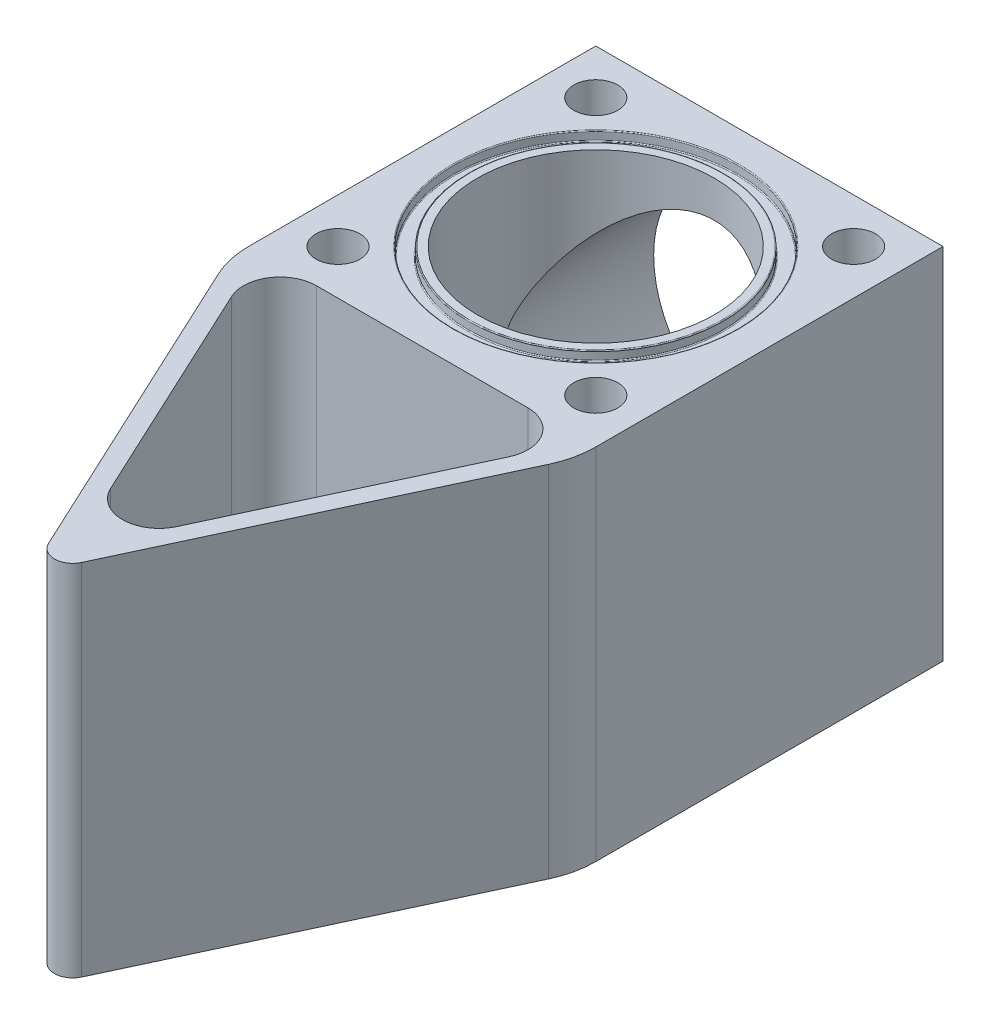
from build123d import *

# Parameters (mm, degrees)
SKETCH1_W                       = 39.4
SKETCH1_H                       = 38.1
BOSS_EXTRUDE1_DEPTH             = 19.05
SKETCH1_4_W                     = 12.7
SKETCH1_4_H                     = 19.05
SKETCH1_5_W                     = 1
SKETCH1_5_H                     = 1.5875
FILLET2_R                       = 0.1
SKETCH2_R                       = 2.413
CUT_EXTRUDE1_DEPTH              = 10
EXTRUDE_THIN1_REACH             = 37.229
EXTRUDE_THIN1_DIRECTION_2_REACH = 37.229
FILLET5_R                       = 4


with BuildPart() as part:
    # Sketch1 → Boss-Extrude1 (new, symmetric)
    with BuildSketch(Plane.YZ):
        with Locations((-3, 0)):
            Rectangle(SKETCH1_W, SKETCH1_H)
    extrude(amount=BOSS_EXTRUDE1_DEPTH, both=True)

    # Sketch1<3> → Cut-Revolve1 (revolve, cut)
    with BuildSketch(Plane.YZ):
        Polygon((16.7, 0), (16.7, 13), (-18.7, 13), (-18.7, 3.96875), (-22.7, 3.96875), (-22.7, 0), align=None)
    revolve(axis=Axis((0, 16.7, 0), (0, -1, 0)), mode=Mode.SUBTRACT)

    # Sketch1<4> → Cut-Revolve2 (revolve, cut)
    with BuildSketch(Plane.YZ):
        with Locations((6.35, -9.525)):
            Rectangle(SKETCH1_4_W, SKETCH1_4_H)
    revolve(axis=Axis((0, 0, 0), (0, 0, -1)), mode=Mode.SUBTRACT)

    # Sketch1<5> → Cut-Revolve3 (revolve, cut)
    with BuildSketch(Plane.YZ):
        with Locations((16.2, 14.79375)):
            Rectangle(SKETCH1_5_W, SKETCH1_5_H)
    revolve(axis=Axis((0, 16.7, 0), (0, -1, 0)), mode=Mode.SUBTRACT)

    # Fillet2
    fillet2_edges = [part.edges().sort_by_distance(p)[0] for p in [
        (0, 16.7, -15.5875),
        (0, 15.7, -15.5875),
        (0, 15.7, -14),
        (0, 16.7, -14),
    ]]
    fillet(fillet2_edges, radius=FILLET2_R)

    # Sketch2 → Cut-Extrude1 (cut)
    with BuildSketch(Plane(origin=(0, 16.7, 0), x_dir=(-1, 0, 0), z_dir=(0, 1, 0))):
        with Locations((-14.142135624, 14.142135624)):
            Circle(SKETCH2_R)
        with Locations((14.142135624, 14.142135624)):
            Circle(SKETCH2_R)
        with Locations((14.142135624, -14.142135624)):
            Circle(SKETCH2_R)
        with Locations((-14.142135624, -14.142135624)):
            Circle(SKETCH2_R)
    extrude(amount=-CUT_EXTRUDE1_DEPTH, mode=Mode.SUBTRACT)

    # Extrude-Thin1: up to this face of the body (flat: up to its plane)
    extrude_thin1_end = Plane(part.part.faces().sort_by_distance((-18.511184633, 16.7, 0))[0])
    # Sketch3 → Extrude-Thin1 (add, up to the picked face)
    with BuildSketch(Plane(origin=(0, 0, 0), x_dir=(-1, 0, 0), z_dir=(0, 1, 0)), mode=Mode.PRIVATE) as extrude_thin1_sk1:
        with BuildLine():
            ThreePointArc((-19.05, 19.05), (-18.812960071, 21.214396139), (-18.11307787, 23.276182617))
            Line((-18.11307787, 23.276182617), (-1.812615574, 58.232636819))
            ThreePointArc((-1.812615574, 58.232636819), (0, 59.387400296), (1.812615574, 58.232636819))
            Line((1.812615574, 58.232636819), (18.11307787, 23.276182617))
            ThreePointArc((18.11307787, 23.276182617), (18.812960071, 21.214396139), (19.05, 19.05))
            Line((19.05, 19.05), (17.05, 19.05))
            ThreePointArc((17.05, 19.05), (16.860368057, 20.781516912), (16.300462296, 22.430946094))
            Line((16.300462296, 22.430946094), (0, 57.387400296))
            Line((0, 57.387400296), (-16.300462296, 22.430946094))
            ThreePointArc((-16.300462296, 22.430946094), (-16.860368057, 20.781516912), (-17.05, 19.05))
            Line((-17.05, 19.05), (-19.05, 19.05))
        make_face()
    extrude_thin1_tool1 = split(extrude(extrude_thin1_sk1.sketch, amount=EXTRUDE_THIN1_REACH, mode=Mode.PRIVATE), bisect_by=extrude_thin1_end, keep=Keep.BOTH, mode=Mode.PRIVATE)
    add(extrude_thin1_tool1.solids().sort_by(Axis((18.271251, 0, 21.094302), (0, 1, 0)))[0])

    # Extrude-Thin1 direction 2: up to this face of the body (flat: up to its plane)
    extrude_thin1_direction_2_end = Plane(part.part.faces().sort_by_distance((0, -22.7, 18.511184633))[0])
    # Sketch3 → Extrude-Thin1 direction 2 (add, up to the picked face)
    with BuildSketch(Plane(origin=(0, 0, 0), x_dir=(-1, 0, 0), z_dir=(0, 1, 0)), mode=Mode.PRIVATE) as extrude_thin1_direction_2_sk1:
        with BuildLine():
            ThreePointArc((-19.05, 19.05), (-18.812960071, 21.214396139), (-18.11307787, 23.276182617))
            Line((-18.11307787, 23.276182617), (-1.812615574, 58.232636819))
            ThreePointArc((-1.812615574, 58.232636819), (0, 59.387400296), (1.812615574, 58.232636819))
            Line((1.812615574, 58.232636819), (18.11307787, 23.276182617))
            ThreePointArc((18.11307787, 23.276182617), (18.812960071, 21.214396139), (19.05, 19.05))
            Line((19.05, 19.05), (17.05, 19.05))
            ThreePointArc((17.05, 19.05), (16.860368057, 20.781516912), (16.300462296, 22.430946094))
            Line((16.300462296, 22.430946094), (0, 57.387400296))
            Line((0, 57.387400296), (-16.300462296, 22.430946094))
            ThreePointArc((-16.300462296, 22.430946094), (-16.860368057, 20.781516912), (-17.05, 19.05))
            Line((-17.05, 19.05), (-19.05, 19.05))
        make_face()
    extrude_thin1_direction_2_tool1 = split(extrude(extrude_thin1_direction_2_sk1.sketch, amount=-EXTRUDE_THIN1_DIRECTION_2_REACH, mode=Mode.PRIVATE), bisect_by=extrude_thin1_direction_2_end, keep=Keep.BOTH, mode=Mode.PRIVATE)
    add(extrude_thin1_direction_2_tool1.solids().sort_by(Axis((18.271251, 0, 21.094302), (0, -1, 0)))[0])

    # Fillet5
    fillet5_edges = [part.edges().sort_by_distance(p)[0] for p in [
        (0, -3, 57.387400296),
        (17.05, -3, 19.05),
        (-17.05, -3, 19.05),
    ]]
    fillet(fillet5_edges, radius=FILLET5_R)


solid = part.part
